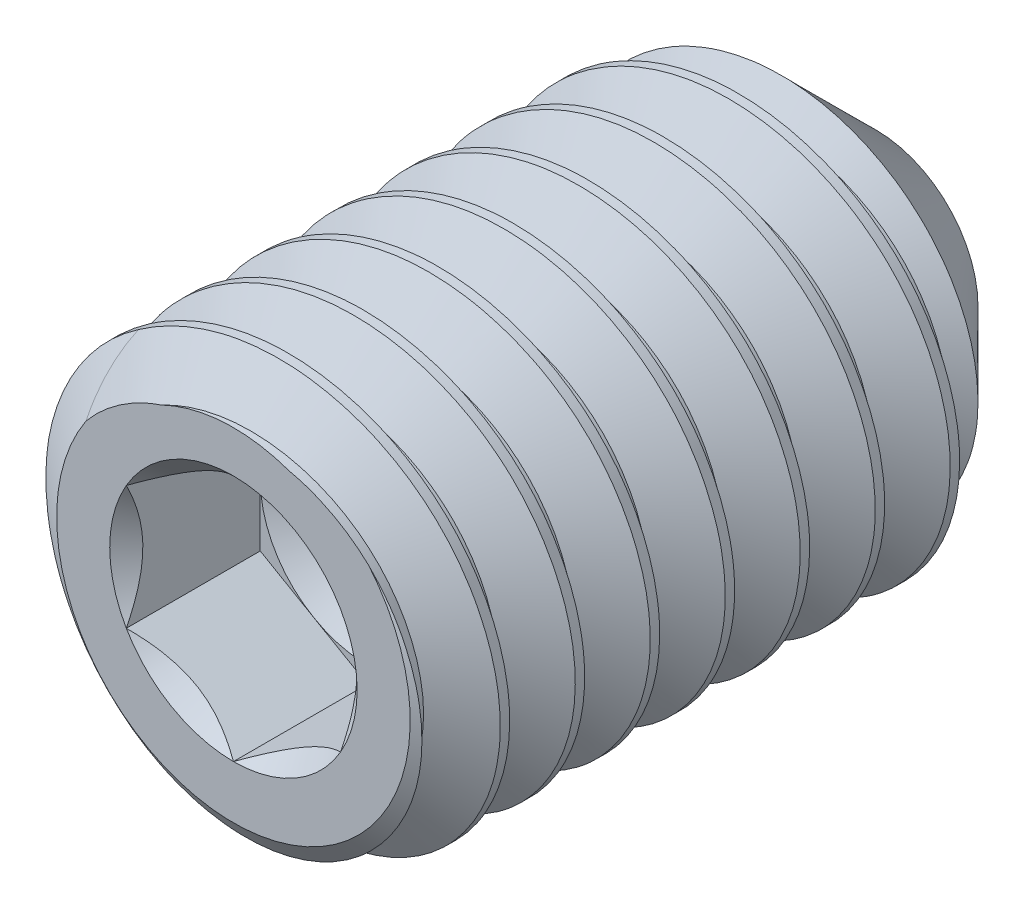
from build123d import *

# Parameters (mm, degrees)
CUT_EXTRUDE1_DEPTH = 1.25
CUT_SWEEP1_PITCH   = 0.7


with BuildPart() as part:
    # Sketch11 → Revolve1 (revolve)
    with BuildSketch(Plane(origin=(0, 0, 0), x_dir=(0, 0, -1), z_dir=(1, 0, 0)), mode=Mode.PRIVATE) as revolve1_sk:
        Polygon((-3, 0), (-3, 1.65), (-2.754927362, 2), (1.95, 2), (3, 0.95), (2.429182412, 0), align=None)
    revolve(revolve1_sk.sketch.rotate(Axis((0, 0, -2.429182412), (0, 0, -1)), 180), axis=Axis((0, 0, -2.429182412), (0, 0, -1)))

    # Sketch2 → Cut-Extrude1 (cut)
    with BuildSketch(Plane.XY.offset(3)):
        Polygon((0, 1.154700538), (-1, 0.577350269), (-1, -0.577350269), (0, -1.154700538), (1, -0.577350269), (1, 0.577350269), align=None)
    extrude(amount=-CUT_EXTRUDE1_DEPTH, mode=Mode.SUBTRACT)

    # Cut-Extrude2 cone 1 section (through the dimple's axis) → Cut-Extrude2 (revolve, cut)
    with BuildSketch(Plane(origin=(0, 0, 3), x_dir=(0, -1, 0), z_dir=(1, 0, 0))):
        Polygon((0, 0), (1.154700538, 0), (0, 1.154700538), align=None)
    revolve(axis=Axis((0, 0, 3), (0, 0, -1)), mode=Mode.SUBTRACT)

    # Cut-Extrude3 cone 1 section (through the dimple's axis) → Cut-Extrude3 (revolve, cut)
    with BuildSketch(Plane(origin=(0, 0, 1.75), x_dir=(0, -1, 0), z_dir=(1, 0, 0))):
        Polygon((0, 0), (1, 0), (0, 0.577350269), align=None)
    revolve(axis=Axis((0, 0, 1.75), (0, 0, -1)), mode=Mode.SUBTRACT)

    # Cut-Sweep1: the profile of Sketch6 screwed along a right-hand helix of 9.428571 turns, 6 arcs to a turn; built about Z, then put on its axis
    cut_sweep1_z = Axis((0, 0, 0), (0, 0, 1))
    cut_sweep1_corners = [(1.545336663, 0, -0.2625), (2.037888611, 0, 0.021875), (2.037888611, 0, -0.634375), (1.545336663, 0, -0.35)]
    with BuildLine(mode=Mode.PRIVATE) as cut_sweep1_profile:
        Line(cut_sweep1_corners[0], cut_sweep1_corners[1])
        Line(cut_sweep1_corners[1], cut_sweep1_corners[2])
        Line(cut_sweep1_corners[2], cut_sweep1_corners[3])
        Line(cut_sweep1_corners[3], cut_sweep1_corners[0])
    cut_sweep1_cap = Face(cut_sweep1_profile.wire())
    cut_sweep1_turn_angles = [0, 30, 60, 90, 120, 150, 180, 210, 240, 270, 300, 330, 360]
    cut_sweep1_turn_weights = [1, 0.8660254037844387, 1, 0.8660254037844387, 1, 0.8660254037844387, 1, 0.8660254037844387, 1, 0.8660254037844387, 1, 0.8660254037844387, 1]
    cut_sweep1_turn_rails = [Edge.make_bspline([Vector(p[0], p[1], 0).rotate(cut_sweep1_z, cut_sweep1_turn_angles[k]) / cut_sweep1_turn_weights[k] + Vector(0, 0, p[2] + CUT_SWEEP1_PITCH * cut_sweep1_turn_angles[k] / 360) for k in range(13)], [0, 0, 0, 1, 1, 2, 2, 3, 3, 4, 4, 5, 5, 6, 6, 6], 2, cut_sweep1_turn_weights) for p in cut_sweep1_corners]
    cut_sweep1_turn_sides = [Face.make_surface_from_curves(cut_sweep1_turn_rails[p[0]], cut_sweep1_turn_rails[p[1]]) for p in [(0, 1), (1, 2), (2, 3), (3, 0)]]
    cut_sweep1_last_angles = [3240, 3270, 3300, 3330, 3360, 3377.142857143, 3394.285714286]
    cut_sweep1_last_weights = [1, 0.8660254037844387, 1, 0.8660254037844387, 1, 0.9555728057861164, 1]
    cut_sweep1_last_rails = [Edge.make_bspline([Vector(p[0], p[1], 0).rotate(cut_sweep1_z, cut_sweep1_last_angles[k]) / cut_sweep1_last_weights[k] + Vector(0, 0, p[2] + CUT_SWEEP1_PITCH * cut_sweep1_last_angles[k] / 360) for k in range(7)], [0, 0, 0, 1, 1, 2, 2, 3, 3, 3], 2, cut_sweep1_last_weights) for p in cut_sweep1_corners]
    cut_sweep1_last_sides = [Face.make_surface_from_curves(cut_sweep1_last_rails[p[0]], cut_sweep1_last_rails[p[1]]) for p in [(0, 1), (1, 2), (2, 3), (3, 0)]]
    cut_sweep1 = Plane(origin=(0, 0, -3), x_dir=(0, 1, 0), z_dir=(0, 0, 1)) * Solid(Shell([*[p.moved(Location((0, 0, CUT_SWEEP1_PITCH * i))) for i in range(9) for p in cut_sweep1_turn_sides], *cut_sweep1_last_sides, cut_sweep1_cap, cut_sweep1_cap.rotate(cut_sweep1_z, 3394.285714286).moved(Location((0, 0, CUT_SWEEP1_PITCH * 3394.285714286 / 360)))]))
    add(cut_sweep1, mode=Mode.SUBTRACT)


solid = part.part
